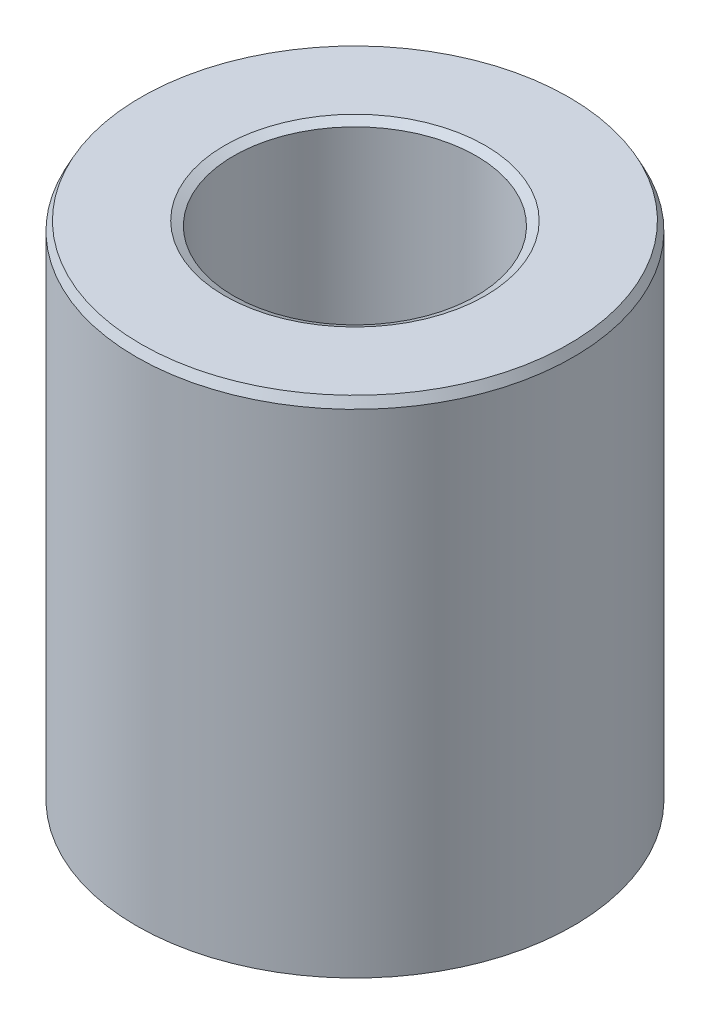
from build123d import *
from OCP.BRepFilletAPI import BRepFilletAPI_MakeChamfer

# Parameters (mm, degrees)
SKETCH1_R           = 30
BOSS_EXTRUDE1_DEPTH = 69.48279872
SKETCH2_R           = 16.661236269
CUT_EXTRUDE1_DEPTH  = 82.411665736
CHAMFER1_SIZE       = 1.229441962
CHAMFER1_SIZE2      = 0.625856387


with BuildPart() as part:
    # Sketch1 → Boss-Extrude1 (new body)
    with BuildSketch(Plane(origin=(0, 0, 0), x_dir=(1, 0, 0), z_dir=(0, 1, 0))):
        Circle(SKETCH1_R)
    extrude(amount=BOSS_EXTRUDE1_DEPTH)

    # Sketch2 → Cut-Extrude1 (cut, through all)
    with BuildSketch(Plane(origin=(0, 0, 0), x_dir=(1, 0, 0), z_dir=(0, 1, 0))):
        Circle(SKETCH2_R)
    extrude(amount=CUT_EXTRUDE1_DEPTH, mode=Mode.SUBTRACT)

    # Chamfer1: one chamfer whose edges measure the first distance from different faces: ONE call of the kernel's chamfer builder (chamfer() names one face for all edges)
    chamfer1_edges_1 = [part.edges().sort_by_distance(p)[0] for p in [
        (-16.661236269, 69.48279872, 0),
    ]]
    chamfer1_side_1 = [part.faces().sort_by_distance(p)[0] for p in [
        (-29.151471863, 69.48279872, 0),
    ]]
    chamfer1_edges_2 = [part.edges().sort_by_distance(p)[0] for p in [
        (-16.661236269, 0, 0),
    ]]
    chamfer1_side_2 = [part.faces().sort_by_distance(p)[0] for p in [
        (-16.661236269, 34.74139936, 0),
    ]]
    chamfer1_edges_3 = [part.edges().sort_by_distance(p)[0] for p in [
        (-30, 0, 0),
    ]]
    chamfer1_side_3 = [part.faces().sort_by_distance(p)[0] for p in [
        (-29.151471863, 0, 0),
    ]]
    chamfer1_edges_4 = [part.edges().sort_by_distance(p)[0] for p in [
        (-30, 69.48279872, 0),
    ]]
    chamfer1_side_4 = [part.faces().sort_by_distance(p)[0] for p in [
        (-30, 34.74139936, 0),
    ]]
    chamfer1 = BRepFilletAPI_MakeChamfer(part.part.solid().wrapped)
    for e in chamfer1_edges_1:
        chamfer1.Add(CHAMFER1_SIZE, CHAMFER1_SIZE2, e.wrapped, chamfer1_side_1[0].wrapped)  # the first distance lies on this face
    for e in chamfer1_edges_2:
        chamfer1.Add(CHAMFER1_SIZE, CHAMFER1_SIZE2, e.wrapped, chamfer1_side_2[0].wrapped)  # the first distance lies on this face
    for e in chamfer1_edges_3:
        chamfer1.Add(CHAMFER1_SIZE, CHAMFER1_SIZE2, e.wrapped, chamfer1_side_3[0].wrapped)  # the first distance lies on this face
    for e in chamfer1_edges_4:
        chamfer1.Add(CHAMFER1_SIZE, CHAMFER1_SIZE2, e.wrapped, chamfer1_side_4[0].wrapped)  # the first distance lies on this face
    add(Compound.cast(chamfer1.Shape()), mode=Mode.REPLACE)


solid = part.part
